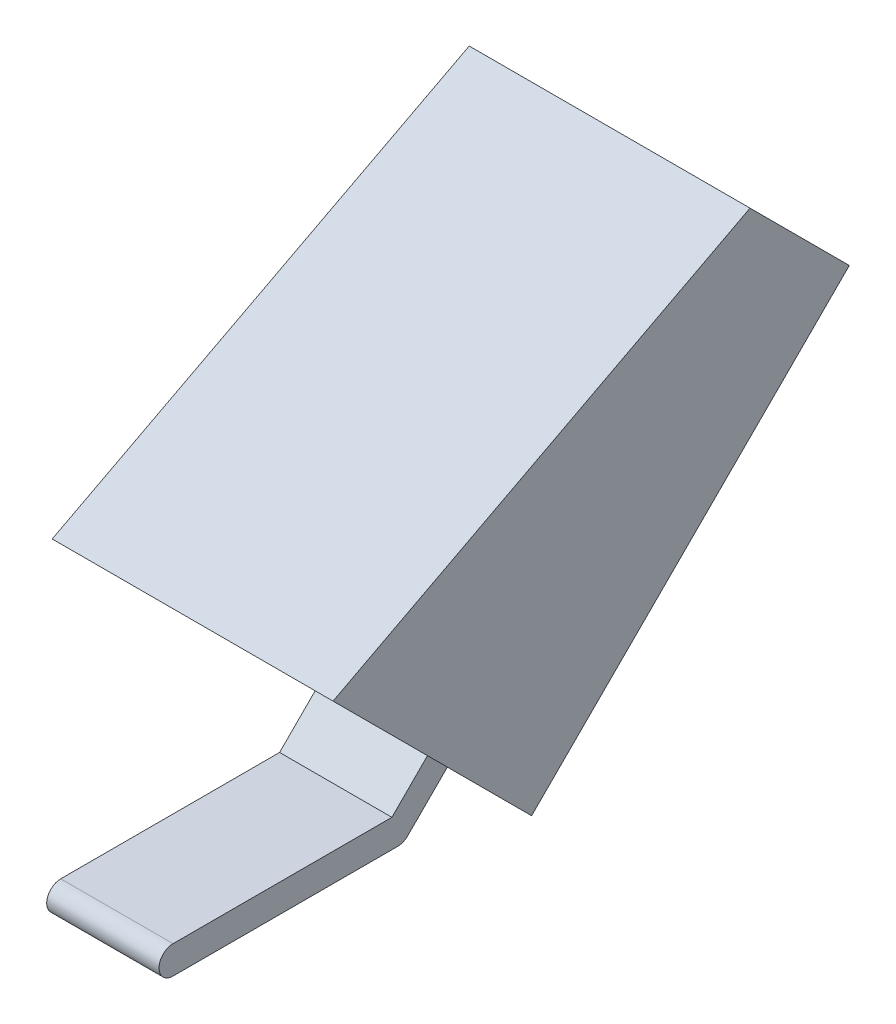
from build123d import *

# Parameters (mm, degrees)
EXTRUDE_2_DEPTH     = 4
SKETCH_5_W          = 20
SKETCH_5_H          = 32
EXTRUDE_5_DEPTH     = 20
CUT_EXTRUDE_3_DEPTH = 20


with BuildPart() as part:
    # 草图1 → 凸台-拉伸2 (new, symmetric)
    with BuildSketch(Plane(origin=(0, 0, 0), x_dir=(0, 0, -1), z_dir=(1, 0, 0))):
        with BuildLine():
            Line((7.585786438, 1), (-8, 1))
            ThreePointArc((-8, 1), (-9, 0), (-8, -1))
            Line((-8, -1), (8, -1))
            ThreePointArc((8, -1), (8.382683432, -0.923879533), (8.707106781, -0.707106781))
            Line((8.707106781, -0.707106781), (28.506096654, 19.091883092))
            ThreePointArc((28.506096654, 19.091883092), (28.506096654, 20.506096654), (27.091883092, 20.506096654))
            Line((27.091883092, 20.506096654), (7.585786438, 1))
        make_face()
    extrude(amount=EXTRUDE_2_DEPTH, both=True)

    # 草图5 → 凸台-拉伸5 (add)
    with BuildSketch(Plane(origin=(0, -4.707106781, -4.707106781), x_dir=(1, 0, 0), z_dir=(0, -0.7071067811865462, -0.7071067811865488))):
        with Locations((0, -25.656854249)):
            Rectangle(SKETCH_5_W, SKETCH_5_H)
    extrude(amount=-EXTRUDE_5_DEPTH)

    # 草图6 → 切除-拉伸3 (cut)
    with BuildSketch(Plane.ZY.offset(10)):
        Polygon((2.606601718, 16.263455967), (-27.091883092, 31.819805153), (-20.02081528, 38.890872965), align=None)
    extrude(amount=-CUT_EXTRUDE_3_DEPTH, mode=Mode.SUBTRACT)


solid = part.part
